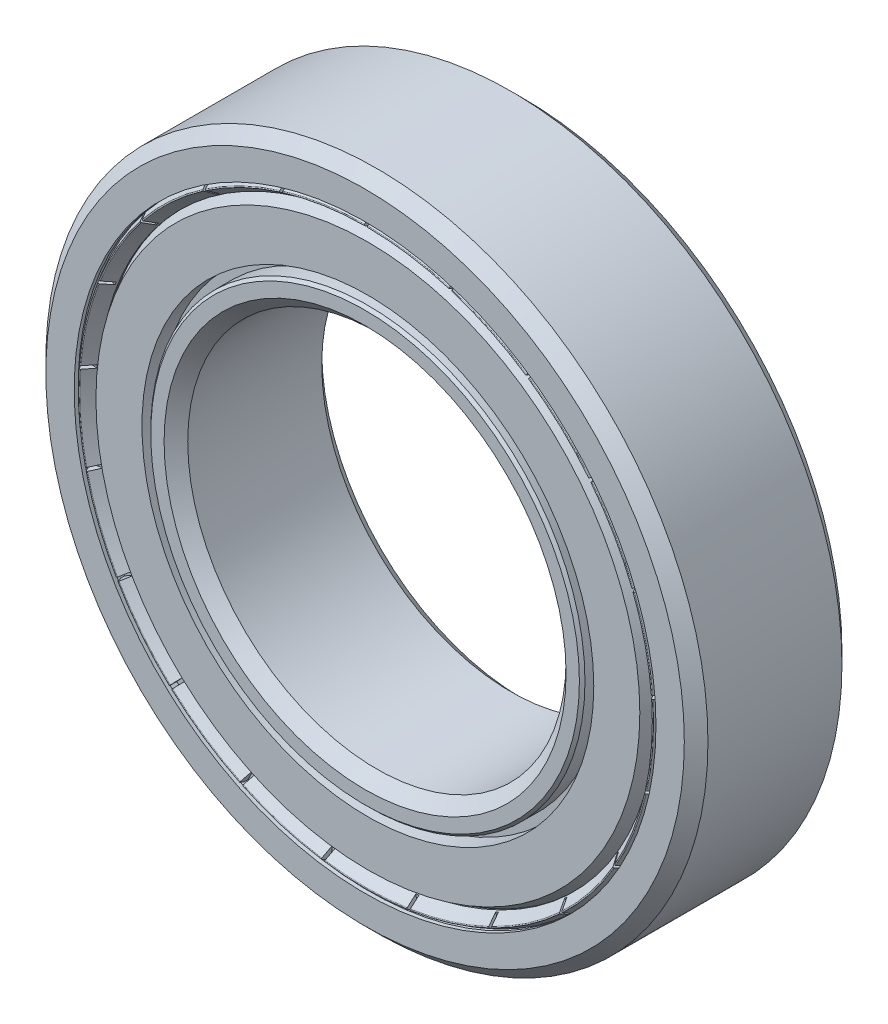
from build123d import *

# Parameters (mm, degrees)
CIRPATTERN1_COUNT  = 10
FILLET1_R          = 0.025
CUT_EXTRUDE1_START = 2.160909
CUT_EXTRUDE1_DEPTH = 13.897311346
CIRPATTERN2_COUNT  = 21


with BuildPart() as part:
    # Sketch3 → Revolve1 (revolve)
    with BuildSketch(Plane(origin=(0, 0, 0), x_dir=(0, 0, -1), z_dir=(1, 0, 0)), mode=Mode.PRIVATE) as revolve1_sk:
        with BuildLine():
            Line((2.125, 10.5), (-2.125, 10.5))
            Line((-2.125, 10.5), (-2.5, 10.125))
            Line((-2.5, 10.125), (-2.5, 9.226203327))
            Line((-2.5, 9.226203327), (-2.375, 9.226203327))
            Line((-2.375, 9.226203327), (-2.375, 9.525601663))
            Line((-2.375, 9.525601663), (-2.286611652, 9.613990011))
            Line((-2.286611652, 9.613990011), (-0.7875, 9.613990011))
            ThreePointArc((-0.7875, 9.613990011), (0, 9.825), (0.7875, 9.613990011))
            Line((0.7875, 9.613990011), (2.286611652, 9.613990011))
            Line((2.286611652, 9.613990011), (2.375, 9.525601663))
            Line((2.375, 9.525601663), (2.375, 9.226203327))
            Line((2.375, 9.226203327), (2.5, 9.226203327))
            Line((2.5, 9.226203327), (2.5, 10.125))
            Line((2.5, 10.125), (2.125, 10.5))
        make_face()
        with BuildLine():
            Line((2.125, 6), (-2.125, 6))
            Line((-2.125, 6), (-2.5, 6.375))
            Line((-2.5, 6.375), (-2.5, 6.797621641))
            Line((-2.5, 6.797621641), (-2.411611652, 6.886009989))
            Line((-2.411611652, 6.886009989), (-0.7875, 6.886009989))
            ThreePointArc((-0.7875, 6.886009989), (0, 6.675), (0.7875, 6.886009989))
            Line((0.7875, 6.886009989), (2.411611652, 6.886009989))
            Line((2.411611652, 6.886009989), (2.5, 6.797621641))
            Line((2.5, 6.797621641), (2.5, 6.375))
            Line((2.5, 6.375), (2.125, 6))
        make_face()
    revolve(revolve1_sk.sketch.rotate(Axis((0, 0, 2.5), (0, 0, -1)), 90), axis=Axis((0, 0, 2.5), (0, 0, -1)))


with BuildPart() as body_2:
    # Sketch4 → Revolve2 (revolve)
    with BuildSketch(Plane(origin=(0, 0, 0), x_dir=(0, 0, -1), z_dir=(1, 0, 0))):
        with BuildLine():
            Line((0, 9.825), (0, 6.675))
            ThreePointArc((0, 6.675), (-1.575, 8.25), (0, 9.825))
        make_face()
    revolve(axis=Axis((0, 10.5, 0), (0, -1, 0)))


with BuildPart() as cirpattern1_1:
    # CirPattern1: pattern copy
    add(body_2.part.rotate(Axis((0, 0, 0), (0, 0, 1)), 1 * 360 / CIRPATTERN1_COUNT))


with BuildPart() as cirpattern1_2:
    # CirPattern1: pattern copy
    add(body_2.part.rotate(Axis((0, 0, 0), (0, 0, 1)), 2 * 360 / CIRPATTERN1_COUNT))


with BuildPart() as cirpattern1_3:
    # CirPattern1: pattern copy
    add(body_2.part.rotate(Axis((0, 0, 0), (0, 0, 1)), 3 * 360 / CIRPATTERN1_COUNT))


with BuildPart() as cirpattern1_4:
    # CirPattern1: pattern copy
    add(body_2.part.rotate(Axis((0, 0, 0), (0, 0, 1)), 4 * 360 / CIRPATTERN1_COUNT))


with BuildPart() as cirpattern1_5:
    # CirPattern1: pattern copy
    add(body_2.part.rotate(Axis((0, 0, 0), (0, 0, 1)), 5 * 360 / CIRPATTERN1_COUNT))


with BuildPart() as cirpattern1_6:
    # CirPattern1: pattern copy
    add(body_2.part.rotate(Axis((0, 0, 0), (0, 0, 1)), 6 * 360 / CIRPATTERN1_COUNT))


with BuildPart() as cirpattern1_7:
    # CirPattern1: pattern copy
    add(body_2.part.rotate(Axis((0, 0, 0), (0, 0, 1)), 7 * 360 / CIRPATTERN1_COUNT))


with BuildPart() as cirpattern1_8:
    # CirPattern1: pattern copy
    add(body_2.part.rotate(Axis((0, 0, 0), (0, 0, 1)), 8 * 360 / CIRPATTERN1_COUNT))


with BuildPart() as cirpattern1_9:
    # CirPattern1: pattern copy
    add(body_2.part.rotate(Axis((0, 0, 0), (0, 0, 1)), 9 * 360 / CIRPATTERN1_COUNT))


with BuildPart() as body_12:
    # Sketch5 → Revolve3 (revolve)
    with BuildSketch(Plane(origin=(0, 0, 0), x_dir=(0, 0, -1), z_dir=(1, 0, 0)), mode=Mode.PRIVATE) as revolve3_sk:
        Polygon((-1.575, 6.886009989), (-1.853870551, 6.886009989), (-1.853870551, 7.16488054), (-2.411611652, 7.16488054), (-2.411611652, 8.625320801), (-1.853870551, 8.947332776), (-1.575, 8.947332776), align=None)
        Polygon((1.853870551, 8.947332776), (1.575, 8.947332776), (1.575, 6.886009989), (1.853870551, 6.886009989), (1.853870551, 7.16488054), (2.411611652, 7.16488054), (2.411611652, 8.625320801), align=None)
    revolve(revolve3_sk.sketch.rotate(Axis((0, 0, 2.5), (0, 0, -1)), 90), axis=Axis((0, 0, 2.5), (0, 0, -1)))


with BuildPart() as body_13:
    # Sketch6 → Revolve4 (revolve)
    with BuildSketch(Plane(origin=(0, 0, 0), x_dir=(0, 0, -1), z_dir=(1, 0, 0)), mode=Mode.PRIVATE) as revolve4_sk:
        Polygon((-2.040568652, 9.226203327), (-2.28125, 9.226203327), (-2.5, 9.099907955), (-2.115568652, 8.830726228), (-2.090568652, 8.830726228), (-2.040568652, 8.839542577), align=None)
    revolve(revolve4_sk.sketch.rotate(Axis((0, 0, 2.5), (0, 0, -1)), 90), axis=Axis((0, 0, 2.5), (0, 0, -1)))

    # Fillet1
    fillet1_edges = [body_13.edges().sort_by_distance(p)[0] for p in [
        (-9.099907955, 0, 2.5),
    ]]
    fillet(fillet1_edges, radius=FILLET1_R)

    # Sketch7 → Cut-Extrude1 (cut, through all)
    with BuildSketch(Plane.XY.offset(CUT_EXTRUDE1_START)):
        Polygon((-0.05, 9.226203327), (-0.05, 9.326203327), (0.05, 9.326203327), (0.05, 9.226203327), (0.05, 8.830726228), (0.05, 8.730726228), (-0.05, 8.730726228), (-0.05, 8.830726228), align=None)
    cut_extrude1 = extrude(amount=CUT_EXTRUDE1_DEPTH, mode=Mode.SUBTRACT)

    # CirPattern2: Cut-Extrude1 ×21 about axis
    cirpattern2_axis = Axis((0, 0, 0), (0, 0, 1))
    for i in range(1, CIRPATTERN2_COUNT):
        add(cut_extrude1.rotate(cirpattern2_axis, i * 360 / CIRPATTERN2_COUNT), mode=Mode.SUBTRACT)


with BuildPart() as body_14:
    # Mirror1: mirrored copy
    add(body_13.part.mirror(Plane.XY))


solid = Compound([part.part, body_2.part, cirpattern1_1.part, cirpattern1_2.part, cirpattern1_3.part, cirpattern1_4.part, cirpattern1_5.part, cirpattern1_6.part, cirpattern1_7.part, cirpattern1_8.part, cirpattern1_9.part, body_12.part, body_13.part, body_14.part])
